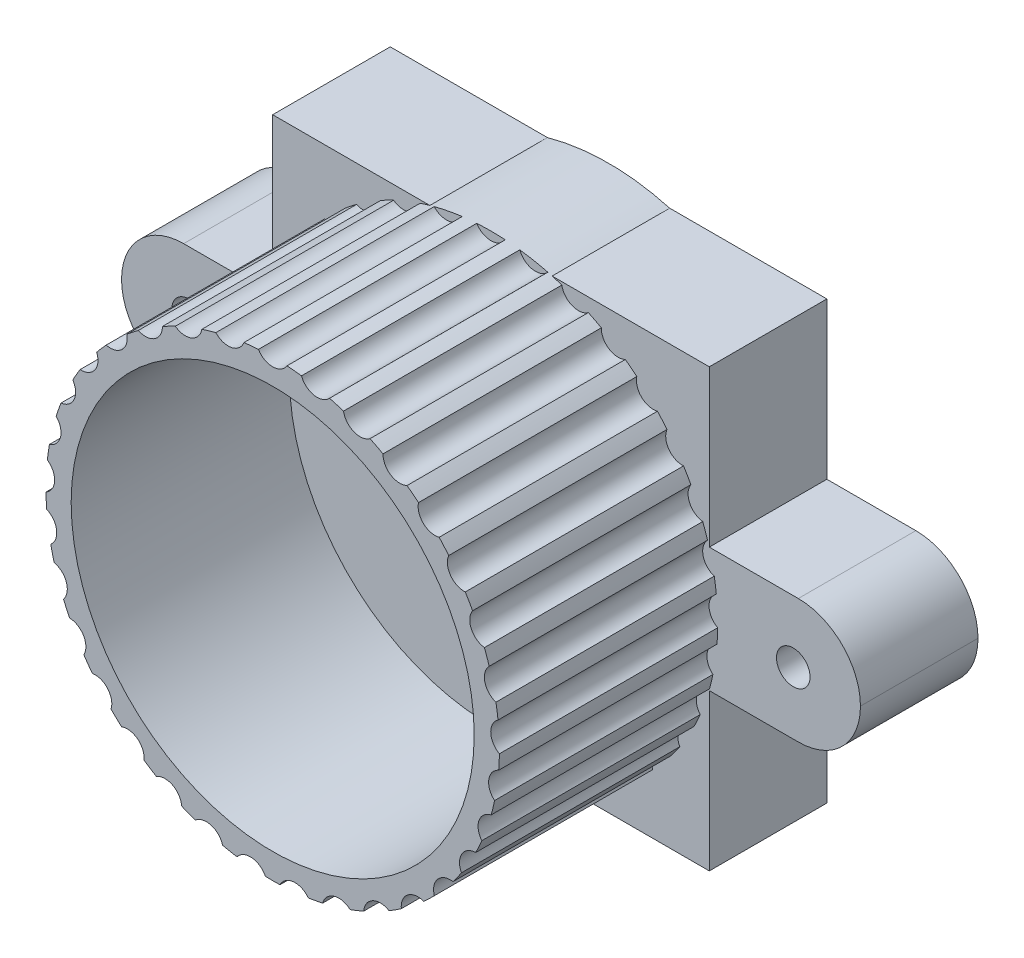
from build123d import *

# Parameters (mm, degrees)
SKETCH1_W                = 13
SKETCH1_H                = 13
BOSS_EXTRUDE1_DEPTH      = 3.5
SKETCH2_W                = 22
SKETCH2_H                = 3.7
BOSS_EXTRUDE2_DEPTH      = 3.5
FILLET1_R                = 1.85
SKETCH3_R                = 0.5
CUT_EXTRUDE1_DEPTH       = 3.5
BOSS_EXTRUDE3_DEPTH      = 6.5
BOSS_EXTRUDE3_DEPTH_BACK = 3.5
SKETCH4_R                = 6.75
SKETCH5_R                = 0.5
CUT_EXTRUDE2_DEPTH       = 6.5
SKETCH6_R                = 6
CUT_EXTRUDE3_DEPTH       = 6.5


with BuildPart() as part:
    # Sketch1 → Boss-Extrude1 (new body)
    with BuildSketch(Plane.XY):
        Rectangle(SKETCH1_W, SKETCH1_H)
    extrude(amount=BOSS_EXTRUDE1_DEPTH)

    # Sketch2 → Boss-Extrude2 (add)
    with BuildSketch(Plane.XY.offset(3.5)):
        Rectangle(SKETCH2_W, SKETCH2_H)
    extrude(amount=-BOSS_EXTRUDE2_DEPTH)

    # Fillet1
    fillet1_edges = [part.edges().sort_by_distance(p)[0] for p in [
        (11, -1.85, 1.75),
        (11, 1.85, 1.75),
        (-11, -1.85, 1.75),
        (-11, 1.85, 1.75),
    ]]
    fillet(fillet1_edges, radius=FILLET1_R - 0.0001)  # a hair under: the kernel refuses the full size

    # Sketch3 → Cut-Extrude1 (cut)
    with BuildSketch(Plane.XY.offset(3.5)):
        with Locations((-9, 0)):
            Circle(SKETCH3_R)
        with Locations((9, 0)):
            Circle(SKETCH3_R)
    extrude(amount=-CUT_EXTRUDE1_DEPTH, mode=Mode.SUBTRACT)

    # Sketch4 → Boss-Extrude3 (add, two sides: drawn at the far end of the back side and taken through both)
    with BuildSketch(Plane.XY.offset(3.5).offset(-BOSS_EXTRUDE3_DEPTH_BACK)):
        Circle(SKETCH4_R)
    extrude(amount=BOSS_EXTRUDE3_DEPTH + BOSS_EXTRUDE3_DEPTH_BACK)

    # Sketch5 → Cut-Extrude2 (cut)
    with BuildSketch(Plane.XY.offset(10)):
        with Locations((0, 7)):
            Circle(SKETCH5_R)
        with Locations((1.324758711, 6.873500881)):
            Circle(SKETCH5_R)
        with Locations((2.60163719, 6.498575531)):
            Circle(SKETCH5_R)
        with Locations((3.784485722, 5.88877473)):
            Circle(SKETCH5_R)
        with Locations((4.83055308, 5.066138267)):
            Circle(SKETCH5_R)
        with Locations((5.702031664, 4.060398367)):
            Circle(SKETCH5_R)
        with Locations((6.367423967, 2.907905091)):
            Circle(SKETCH5_R)
        with Locations((6.802680978, 1.650312549)):
            Circle(SKETCH5_R)
        with Locations((6.992071374, 0.333073411)):
            Circle(SKETCH5_R)
        with Locations((6.928750093, -0.996203868)):
            Circle(SKETCH5_R)
        with Locations((6.615005731, -2.289475743)):
            Circle(SKETCH5_R)
        with Locations((6.062177826, -3.5)):
            Circle(SKETCH5_R)
        with Locations((5.29024702, -4.584025138)):
            Circle(SKETCH5_R)
        with Locations((4.327112904, -5.502371663)):
            Circle(SKETCH5_R)
        with Locations((3.207585652, -6.221848141)):
            Circle(SKETCH5_R)
        with Locations((1.972127898, -6.716450815)):
            Circle(SKETCH5_R)
        with Locations((0.665392303, -6.968303458)):
            Circle(SKETCH5_R)
        with Locations((-0.665392303, -6.968303458)):
            Circle(SKETCH5_R)
        with Locations((-1.972127898, -6.716450815)):
            Circle(SKETCH5_R)
        with Locations((-3.207585652, -6.221848141)):
            Circle(SKETCH5_R)
        with Locations((-4.327112904, -5.502371663)):
            Circle(SKETCH5_R)
        with Locations((-5.29024702, -4.584025138)):
            Circle(SKETCH5_R)
        with Locations((-6.062177826, -3.5)):
            Circle(SKETCH5_R)
        with Locations((-6.615005731, -2.289475743)):
            Circle(SKETCH5_R)
        with Locations((-6.928750093, -0.996203868)):
            Circle(SKETCH5_R)
        with Locations((-6.992071374, 0.333073411)):
            Circle(SKETCH5_R)
        with Locations((-6.802680978, 1.650312549)):
            Circle(SKETCH5_R)
        with Locations((-6.367423967, 2.907905091)):
            Circle(SKETCH5_R)
        with Locations((-5.702031664, 4.060398367)):
            Circle(SKETCH5_R)
        with Locations((-4.83055308, 5.066138267)):
            Circle(SKETCH5_R)
        with Locations((-3.784485722, 5.88877473)):
            Circle(SKETCH5_R)
        with Locations((-2.60163719, 6.498575531)):
            Circle(SKETCH5_R)
        with Locations((-1.324758711, 6.873500881)):
            Circle(SKETCH5_R)
    extrude(amount=-CUT_EXTRUDE2_DEPTH, mode=Mode.SUBTRACT)

    # Sketch6 → Cut-Extrude3 (cut)
    with BuildSketch(Plane.XY.offset(10)):
        Circle(SKETCH6_R)
    extrude(amount=-CUT_EXTRUDE3_DEPTH, mode=Mode.SUBTRACT)


solid = part.part
